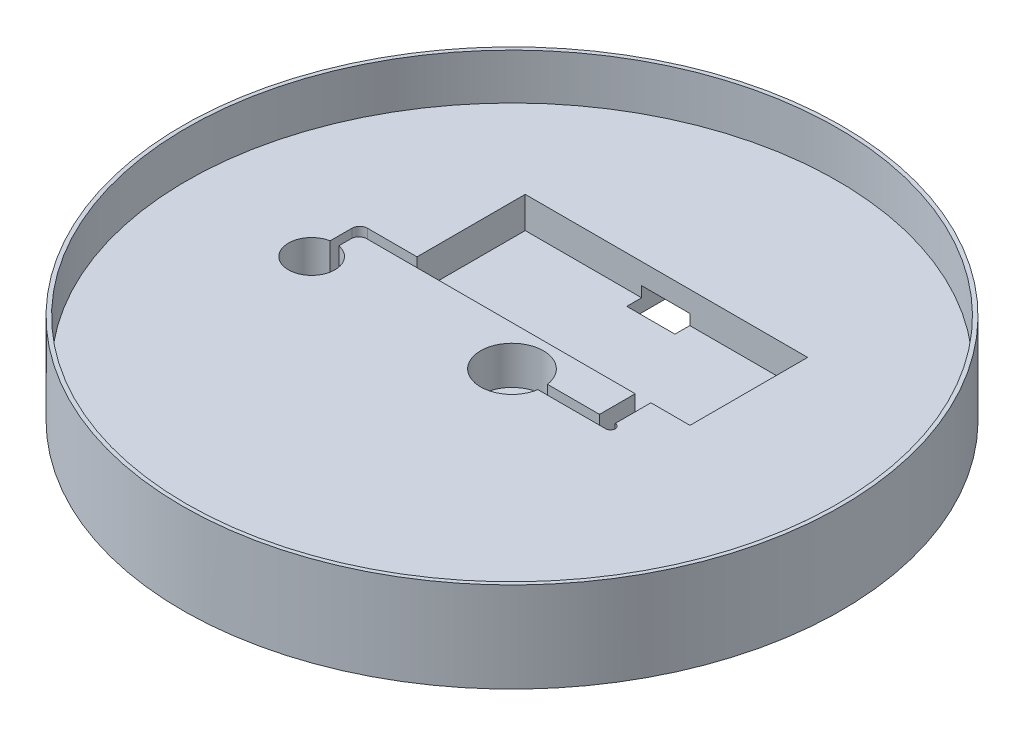
from build123d import *

# Parameters (mm, degrees)
SKETCH1_R           = 266.7
BOSS_EXTRUDE1_DEPTH = 73.025
SKETCH2_R           = 263.525
CUT_EXTRUDE1_DEPTH  = 37.084
SKETCH3_R           = 25.4
CUT_EXTRUDE2_DEPTH  = 30.988
CUT_EXTRUDE3_DEPTH  = 379.989449795
CUT_EXTRUDE12_DEPTH = 27.94
CUT_EXTRUDE13_DEPTH = 25.4
CUT_EXTRUDE14_DEPTH = 25.4
SKETCH21_W          = 38.994551816
SKETCH21_H          = 168.221568793
CUT_EXTRUDE15_DEPTH = 19.05


with BuildPart() as part:
    # Sketch1 → Boss-Extrude1 (new body)
    with BuildSketch(Plane(origin=(0, 0, 0), x_dir=(1, 0, 0), z_dir=(0, 1, 0))):
        Circle(SKETCH1_R)
    extrude(amount=BOSS_EXTRUDE1_DEPTH)

    # Sketch2 → Cut-Extrude1 (cut)
    with BuildSketch(Plane(origin=(0, 73.025, 0), x_dir=(1, 0, 0), z_dir=(0, 1, 0))):
        Circle(SKETCH2_R)
    extrude(amount=-CUT_EXTRUDE1_DEPTH, mode=Mode.SUBTRACT)

    # Sketch3 → Cut-Extrude2 (cut)
    with BuildSketch(Plane(origin=(0, 35.941, 0), x_dir=(1, 0, 0), z_dir=(0, 1, 0))):
        Circle(SKETCH3_R)
    extrude(amount=-CUT_EXTRUDE2_DEPTH, mode=Mode.SUBTRACT)

    # Sketch4 → Cut-Extrude3 (cut, through all)
    with BuildSketch(Plane(origin=(0, 35.941, 0), x_dir=(1, 0, 0), z_dir=(0, 1, 0))):
        with BuildLine():
            Line((3.81, 3.511669421), (80.01, 3.511669421))
            ThreePointArc((80.01, 3.511669421), (83.82, -0.298330579), (80.01, -4.108330579))
            Line((80.01, -4.108330579), (3.81, -4.108330579))
            ThreePointArc((3.81, -4.108330579), (0, -0.298330579), (3.81, 3.511669421))
        make_face()
    extrude(amount=-CUT_EXTRUDE3_DEPTH, mode=Mode.SUBTRACT)

    # Sketch15 → Cut-Extrude12 (cut)
    with BuildSketch(Plane(origin=(0, 35.941, 0), x_dir=(1, 0, 0), z_dir=(0, 1, 0))):
        with BuildLine():
            Line((-156.324841444, 16.153250023), (-156.324841444, 18.479175021))
            Line((-156.324841444, 18.479175021), (-163.351634066, 18.479175021))
            Line((-163.351634066, 18.479175021), (-163.351634066, 16.153250023))
            ThreePointArc((-163.351634066, 16.153250023), (-159.838237755, -21.107463957), (-156.324841444, 16.153250023))
        make_face()
    extrude(amount=-CUT_EXTRUDE12_DEPTH, mode=Mode.SUBTRACT)

    # Sketch19 → Cut-Extrude13 (cut)
    with BuildSketch(Plane(origin=(0, 35.941, 0), x_dir=(1, 0, 0), z_dir=(0, 1, 0))):
        Polygon((80.01, 3.511669421), (80.01, 32.408172399), (111.633958253, 32.408172399), (111.633958253, 127.658172399), (-116.966041747, 127.658172399), (-116.966041747, 32.408172399), (67.31, 32.408172399), (67.31, 3.511669421), align=None)
    extrude(amount=-CUT_EXTRUDE13_DEPTH, mode=Mode.SUBTRACT)

    # Sketch20 → Cut-Extrude14 (cut)
    with BuildSketch(Plane(origin=(0, 35.941, 0), x_dir=(1, 0, 0), z_dir=(0, 1, 0))):
        with BuildLine():
            Line((-116.966041747, 32.408172399), (-149.974841444, 32.408172399))
            ThreePointArc((-149.974841444, 32.408172399), (-154.464969504, 30.548300459), (-156.324841444, 26.058172399))
            Line((-156.324841444, 26.058172399), (-156.324841444, 18.479175021))
            Line((-156.324841444, 18.479175021), (-163.351634066, 18.479175021))
            Line((-163.351634066, 18.479175021), (-163.351634066, 33.721665135))
            ThreePointArc((-163.351634066, 33.721665135), (-161.491762127, 38.211793195), (-157.001634066, 40.071665135))
            Line((-157.001634066, 40.071665135), (-116.966041747, 40.071665135))
            Line((-116.966041747, 40.071665135), (-116.966041747, 32.408172399))
        make_face()
    extrude(amount=-CUT_EXTRUDE14_DEPTH, mode=Mode.SUBTRACT)

    # Sketch21 → Cut-Extrude15 (cut)
    with BuildSketch(Plane(origin=(0, 0, 0), x_dir=(-1, 0, 0), z_dir=(0, -1, 0))):
        with Locations((3.268316006, 199.749927686)):
            Rectangle(SKETCH21_W, SKETCH21_H)
    extrude(amount=-CUT_EXTRUDE15_DEPTH, mode=Mode.SUBTRACT)


solid = part.part
